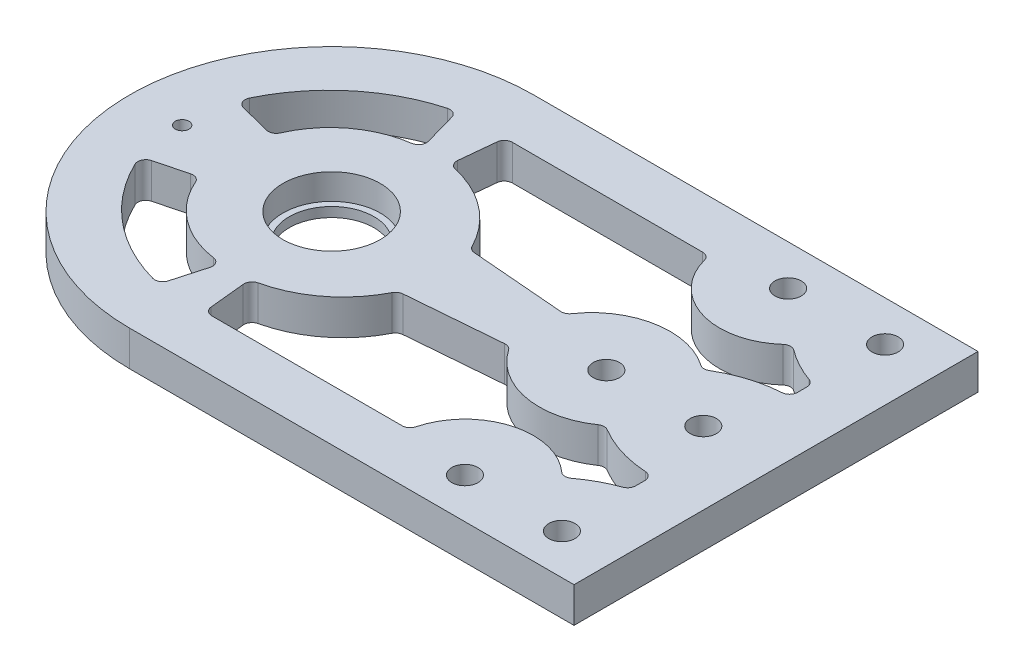
from build123d import *

# Parameters (mm, degrees)
SKETCH1_R           = 3.25
SKETCH1_R_2         = 10.5
BOSS_EXTRUDE1_DEPTH = 8.73125
SKETCH2_R           = 12.05
CUT_EXTRUDE1_DEPTH  = 6.35
SKETCH6_R           = 1.7
CUT_EXTRUDE4_DEPTH  = 189.881536225
FILLET1_R           = 2


with BuildPart() as part:
    # Sketch1 → Boss-Extrude1 (new body)
    with BuildSketch(Plane(origin=(0, 0, 0), x_dir=(1, 0, 0), z_dir=(0, 1, 0))):
        with BuildLine():
            Line((-110, -100), (0, -100))
            Line((0, -100), (0, 0))
            Line((0, 0), (-110, 0))
            ThreePointArc((-110, 0), (-160, -50), (-110, -100))
        make_face()
        with Locations((-13, -10)):
            Circle(SKETCH1_R, mode=Mode.SUBTRACT)
        with Locations((-37, -10)):
            Circle(SKETCH1_R, mode=Mode.SUBTRACT)
        with Locations((-18, -50)):
            Circle(SKETCH1_R, mode=Mode.SUBTRACT)
        with Locations((-13, -90)):
            Circle(SKETCH1_R, mode=Mode.SUBTRACT)
        with Locations((-37, -90)):
            Circle(SKETCH1_R, mode=Mode.SUBTRACT)
        with Locations((-42, -50)):
            Circle(SKETCH1_R, mode=Mode.SUBTRACT)
        with Locations((-110, -50)):
            Circle(SKETCH1_R_2, mode=Mode.SUBTRACT)
    extrude(amount=BOSS_EXTRUDE1_DEPTH)

    # Sketch2 → Cut-Extrude1 (cut)
    with BuildSketch(Plane(origin=(0, 8.73125, 0), x_dir=(1, 0, 0), z_dir=(0, 1, 0))):
        with Locations((-110, -50)):
            Circle(SKETCH2_R)
    extrude(amount=-CUT_EXTRUDE1_DEPTH, mode=Mode.SUBTRACT)

    # Sketch6 → Cut-Extrude4 (cut, through all)
    with BuildSketch(Plane(origin=(0, 8.73125, 0), x_dir=(1, 0, 0), z_dir=(0, 1, 0))):
        with Locations((-147, -50)):
            Circle(SKETCH6_R)
        with BuildLine():
            Line((-133.793921789, -41.071004616), (-145.477766874, -38.051775556))
            ThreePointArc((-145.477766874, -38.051775556), (-133.72851482, -21.93564785), (-115.86984126, -13.056330604))
            Line((-115.86984126, -13.056330604), (-112.417796121, -25.271259557))
            ThreePointArc((-112.417796121, -25.271259557), (-125.525564083, -29.897413384), (-133.793921789, -41.071004616))
        make_face()
        with BuildLine():
            Line((-105.513705843, -25.271259557), (-104.258758681, -12.795366162))
            Line((-104.258758681, -12.795366162), (-53.734606151, -12.795366162))
            ThreePointArc((-53.734606151, -12.795366162), (-41.801024618, -26.273023002), (-24.46272378, -21.431439979))
            ThreePointArc((-24.46272378, -21.431439979), (-19.304766449, -24.941567185), (-13.556215286, -27.366371581))
            Line((-13.556215286, -27.366371581), (-13.556215286, -33.028900538))
            ThreePointArc((-13.556215286, -33.028900538), (-22.279595055, -34.31177696), (-30.264301501, -38.051775556))
            ThreePointArc((-30.264301501, -38.051775556), (-45.81064331, -34.0967888), (-59.032653211, -43.180241783))
            Line((-59.032653211, -43.180241783), (-84.662721734, -41.071004616))
            ThreePointArc((-84.662721734, -41.071004616), (-93.117084888, -30.569825722), (-105.513705843, -25.271259557))
        make_face()
        with BuildLine():
            Line((-115.86984126, -86.943669396), (-112.417796121, -74.728740443))
            ThreePointArc((-112.417796121, -74.728740443), (-125.525564083, -70.102586616), (-133.793921789, -58.928995384))
            Line((-133.793921789, -58.928995384), (-145.477766874, -61.948224444))
            ThreePointArc((-145.477766874, -61.948224444), (-133.72851482, -78.06435215), (-115.86984126, -86.943669396))
        make_face()
        with BuildLine():
            Line((-104.258758681, -87.204633838), (-53.734606151, -87.204633838))
            ThreePointArc((-53.734606151, -87.204633838), (-41.801024618, -73.726976998), (-24.46272378, -78.568560021))
            ThreePointArc((-24.46272378, -78.568560021), (-19.304766449, -75.058432815), (-13.556215286, -72.633628419))
            Line((-13.556215286, -72.633628419), (-13.556215286, -66.971099462))
            ThreePointArc((-13.556215286, -66.971099462), (-22.279595055, -65.68822304), (-30.264301501, -61.948224444))
            ThreePointArc((-30.264301501, -61.948224444), (-45.81064331, -65.9032112), (-59.032653211, -56.819758217))
            Line((-59.032653211, -56.819758217), (-84.662721734, -58.928995384))
            ThreePointArc((-84.662721734, -58.928995384), (-93.117084888, -69.430174278), (-105.513705843, -74.728740443))
            Line((-105.513705843, -74.728740443), (-104.258758681, -87.204633838))
        make_face()
    extrude(amount=-CUT_EXTRUDE4_DEPTH, mode=Mode.SUBTRACT)

    # Fillet1
    fillet1_edges = [part.edges().sort_by_distance(p)[0] for p in [
        (-84.662721734, 4.365625, 41.071004616),
        (-59.032653211, 4.365625, 43.180241783),
        (-13.556215286, 4.365625, 33.028900538),
        (-30.264301501, 4.365625, 38.051775556),
        (-24.46272378, 4.365625, 78.568560021),
        (-53.734606151, 4.365625, 87.204633838),
        (-13.556215286, 4.365625, 72.633628419),
        (-13.556215286, 4.365625, 66.971099462),
        (-30.264301501, 4.365625, 61.948224444),
        (-59.032653211, 4.365625, 56.819758217),
        (-104.258758681, 4.365625, 87.204633838),
        (-84.662721734, 4.365625, 58.928995384),
        (-105.513705843, 4.365625, 74.728740443),
        (-133.793921789, 4.365625, 41.071004616),
        (-112.417796121, 4.365625, 25.271259557),
        (-115.86984126, 4.365625, 13.056330604),
        (-145.477766874, 4.365625, 38.051775556),
        (-115.86984126, 4.365625, 86.943669396),
        (-112.417796121, 4.365625, 74.728740443),
        (-133.793921789, 4.365625, 58.928995384),
        (-145.477766874, 4.365625, 61.948224444),
        (-13.556215286, 4.365625, 27.366371581),
        (-24.46272378, 4.365625, 21.431439979),
        (-53.734606151, 4.365625, 12.795366162),
        (-104.258758681, 4.365625, 12.795366162),
        (-105.513705843, 4.365625, 25.271259557),
    ]]
    fillet(fillet1_edges, radius=FILLET1_R)


solid = part.part
